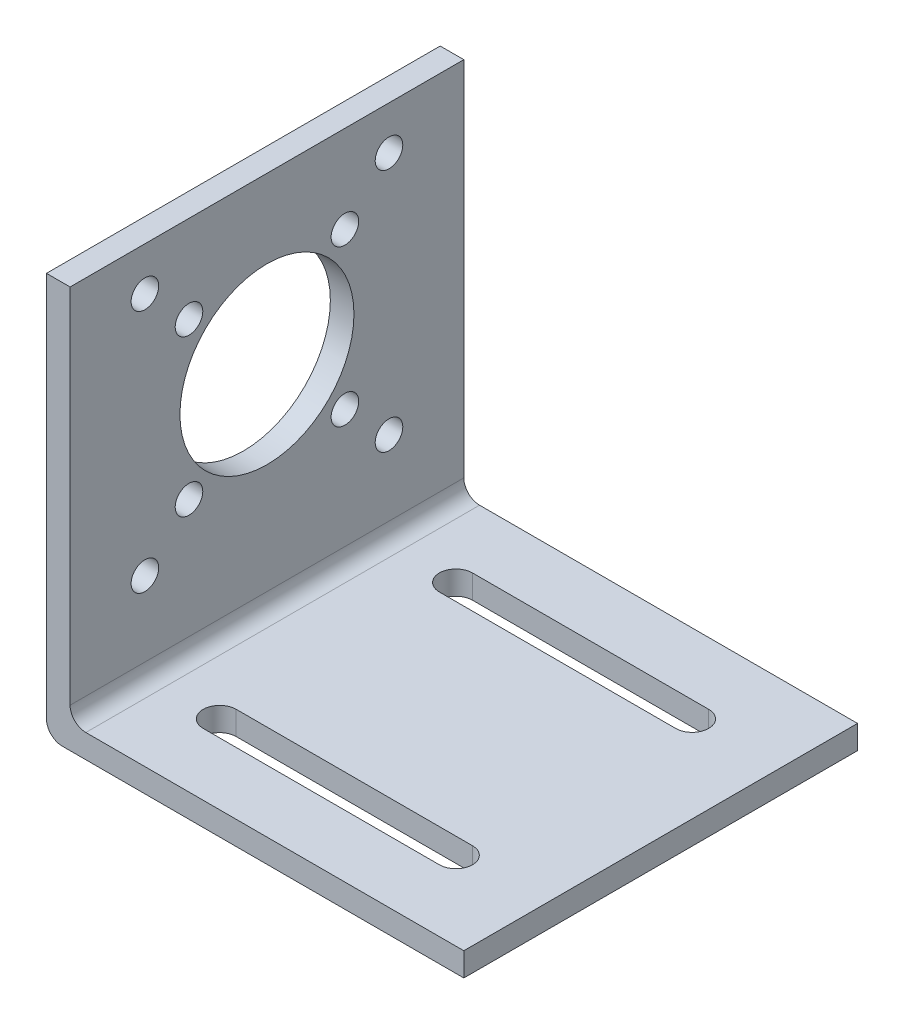
from build123d import *

# Parameters (mm, degrees)
SKETCH1_W           = 53
SKETCH1_H           = 50
BOSS_EXTRUDE1_DEPTH = 3
SKETCH2_W           = 3
SKETCH2_H           = 50
BOSS_EXTRUDE2_DEPTH = 48
CUT_EXTRUDE1_DEPTH  = 88.252507127
FILLET1_R           = 2
SKETCH4_R           = 11.05
SKETCH4_R_2         = 1.75
CUT_EXTRUDE2_DEPTH  = 88.183714076


with BuildPart() as part:
    # Sketch1 → Boss-Extrude1 (new body)
    with BuildSketch(Plane(origin=(0, 0, 0), x_dir=(1, 0, 0), z_dir=(0, 1, 0))):
        with Locations((26.5, 25)):
            Rectangle(SKETCH1_W, SKETCH1_H)
    extrude(amount=BOSS_EXTRUDE1_DEPTH)

    # Sketch2 → Boss-Extrude2 (add)
    with BuildSketch(Plane(origin=(0, 3, 0), x_dir=(1, 0, 0), z_dir=(0, 1, 0))):
        with Locations((1.5, 25)):
            Rectangle(SKETCH2_W, SKETCH2_H)
    extrude(amount=BOSS_EXTRUDE2_DEPTH)

    # Sketch3 → Cut-Extrude1 (cut, through all)
    with BuildSketch(Plane(origin=(0, 3, 0), x_dir=(1, 0, 0), z_dir=(0, 1, 0))):
        with BuildLine():
            Line((42, 42.1), (12, 42.1))
            ThreePointArc((12, 42.1), (9.9, 40), (12, 37.9))
            Line((12, 37.9), (42, 37.9))
            ThreePointArc((42, 37.9), (44.1, 40), (42, 42.1))
        make_face()
        with BuildLine():
            ThreePointArc((12, 12.1), (9.9, 10), (12, 7.9))
            Line((12, 7.9), (42, 7.9))
            ThreePointArc((42, 7.9), (44.1, 10), (42, 12.1))
            Line((42, 12.1), (12, 12.1))
        make_face()
    extrude(amount=-CUT_EXTRUDE1_DEPTH, mode=Mode.SUBTRACT)

    # Fillet1
    fillet1_edges = [part.edges().sort_by_distance(p)[0] for p in [
        (3, 3, -25),
        (0, 0, -25),
    ]]
    fillet(fillet1_edges, radius=FILLET1_R)

    # Sketch4 → Cut-Extrude2 (cut, through all)
    with BuildSketch(Plane(origin=(3, 0, 0), x_dir=(0, 0, -1), z_dir=(1, 0, 0))):
        with Locations((25, 30)):
            Circle(SKETCH4_R)
        with Locations((34.898989847, 39.9)):
            Circle(SKETCH4_R_2)
        with Locations((15.101010153, 39.9)):
            Circle(SKETCH4_R_2)
        with Locations((15.101010153, 20.1)):
            Circle(SKETCH4_R_2)
        with Locations((34.898989847, 20.1)):
            Circle(SKETCH4_R_2)
        with Locations((9.5, 45.5)):
            Circle(SKETCH4_R_2)
        with Locations((40.5, 45.5)):
            Circle(SKETCH4_R_2)
        with Locations((9.5, 14.5)):
            Circle(SKETCH4_R_2)
        with Locations((40.5, 14.5)):
            Circle(SKETCH4_R_2)
    extrude(amount=-CUT_EXTRUDE2_DEPTH, mode=Mode.SUBTRACT)


solid = part.part
